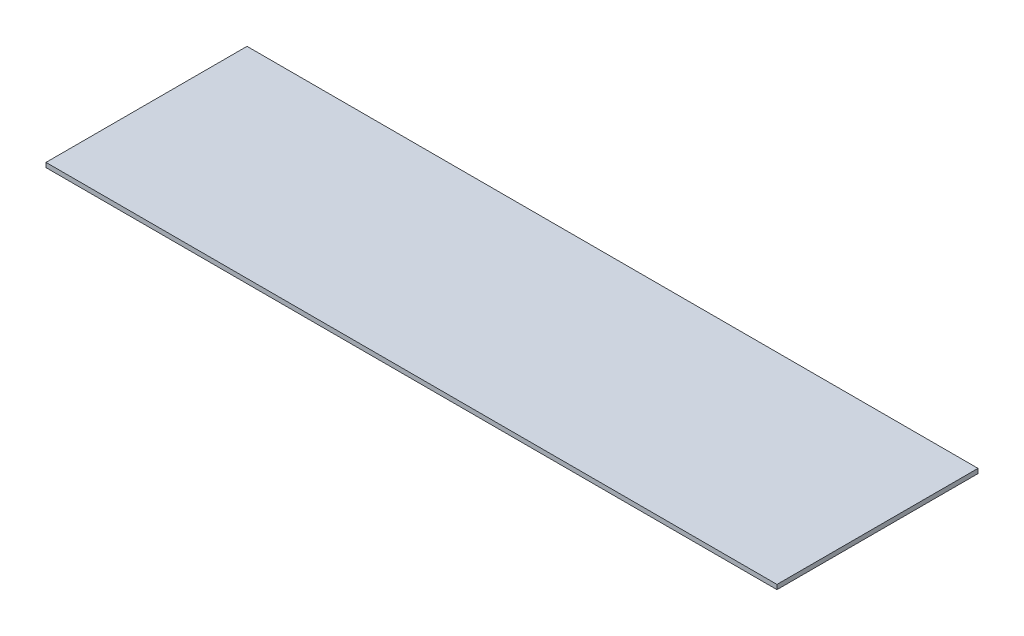
from build123d import *

# Parameters (mm, degrees)
SKETCH1_W           = 508
SKETCH1_H           = 139.7
BOSS_EXTRUDE1_DEPTH = 3.175


with BuildPart() as part:
    # Sketch1 → Boss-Extrude1 (new body)
    with BuildSketch(Plane(origin=(0, 0, 0), x_dir=(1, 0, 0), z_dir=(0, 1, 0))):
        with Locations((254, -69.85)):
            Rectangle(SKETCH1_W, SKETCH1_H)
    extrude(amount=BOSS_EXTRUDE1_DEPTH)


solid = part.part
